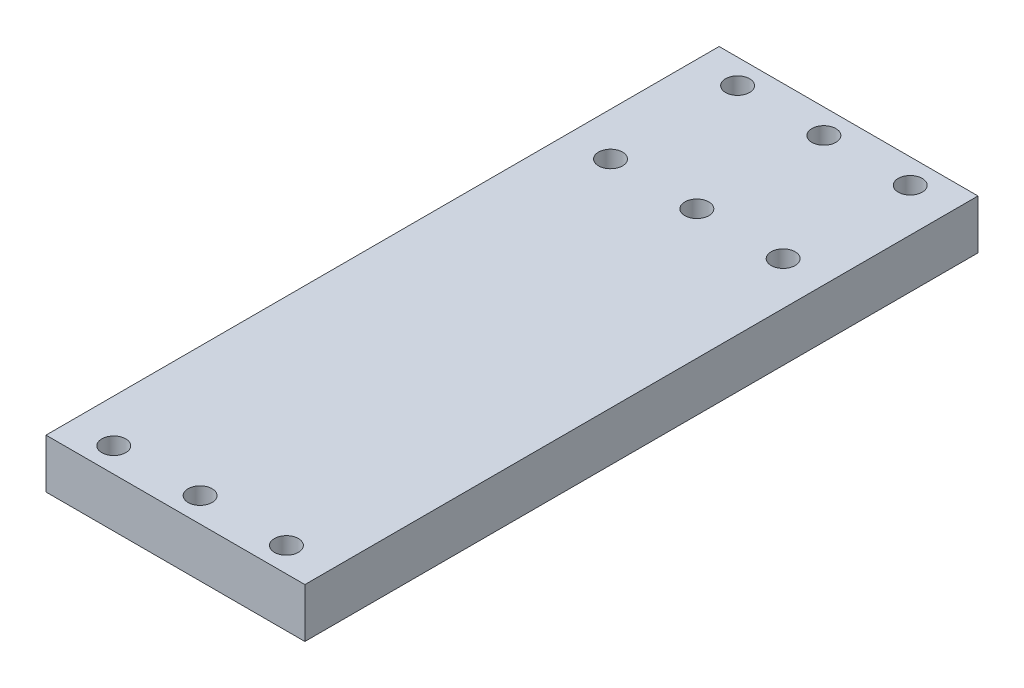
from build123d import *

# Parameters (mm, degrees)
SKETCH2_W                = 50
SKETCH2_H                = 130
BOSS_EXTRUDE1_DEPTH      = 9.525
M4_CLEARANCE_HOLE1_D     = 4.635
M4_CLEARANCE_HOLE1_DEPTH = 10
M4_CLEARANCE_HOLE1_TIP   = 1.392494485


with BuildPart() as part:
    # Sketch2 → Boss-Extrude1 (new body)
    with BuildSketch(Plane(origin=(0, 0, 0), x_dir=(1, 0, 0), z_dir=(0, 1, 0))):
        Rectangle(SKETCH2_W, SKETCH2_H)
    extrude(amount=BOSS_EXTRUDE1_DEPTH)

    # M4 Clearance Hole1
    with Locations(Plane(origin=(0, 9.525, 0), x_dir=(1, 0, 0), z_dir=(0, 1, 0))):
        with Locations((16.67, 60.2375), (-16.67, -60.2375), (0, -60.2375), (16.67, -60.2375), (-16.67, 35.7), (0, 35.7), (16.67, 35.7), (-16.67, 60.2375), (0, 60.2375)):
            Hole(M4_CLEARANCE_HOLE1_D / 2, depth=M4_CLEARANCE_HOLE1_DEPTH)
            with Locations((0, 0, -(M4_CLEARANCE_HOLE1_DEPTH + M4_CLEARANCE_HOLE1_TIP / 2))):  # 118° drill point
                Cone(0, M4_CLEARANCE_HOLE1_D / 2, M4_CLEARANCE_HOLE1_TIP, mode=Mode.SUBTRACT)


solid = part.part
